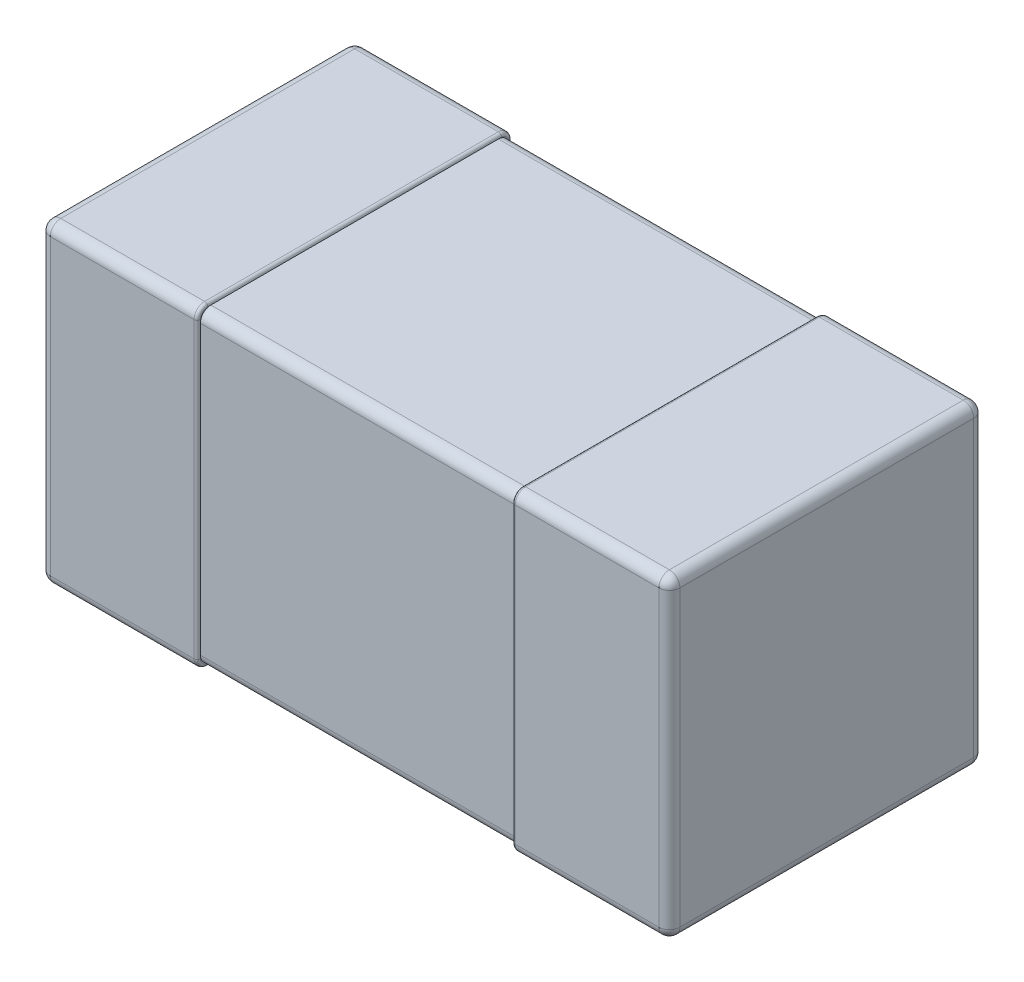
from build123d import *

# Parameters (mm, degrees)
SKETCH1_W                           = 0.6
SKETCH1_H                           = 0.3
ALL_BODY_DEPTH                      = 0.3
CUT_OUT_THE_BODY_FOR_PIN_DEPTH      = 0.15
CUT_OUT_THE_BODY_FOR_PIN_DEPTH_BACK = 0.15
SKETCH2_OUTSIDE_W                   = 2.446
SKETCH2_OUTSIDE_H                   = 2.446
SKETCH2_OUTSIDE_W_2                 = 0.294
SKETCH2_OUTSIDE_H_2                 = 0.294
BODY_FILLET_R                       = 0.01
PIN_FILLET_A_R                      = 0.01
PIN_FILLET_B_R                      = 0.003


with BuildPart() as part:
    # Sketch1 → All body (new body)
    with BuildSketch(Plane.XY):
        Rectangle(SKETCH1_W, SKETCH1_H)
    extrude(amount=ALL_BODY_DEPTH)

    # Sketch2 outside → Cut out the body for pin (cut, two sides: drawn at the far end of the back side and taken through both)
    with BuildSketch(Plane(origin=(0, 0, 0), x_dir=(0, 0, -1), z_dir=(1, 0, 0)).offset(-CUT_OUT_THE_BODY_FOR_PIN_DEPTH_BACK)):
        with Locations((-0.15, 0)):
            Rectangle(SKETCH2_OUTSIDE_W, SKETCH2_OUTSIDE_H)
        with Locations((-0.15, 0)):
            Rectangle(SKETCH2_OUTSIDE_W_2, SKETCH2_OUTSIDE_H_2, mode=Mode.SUBTRACT)
    extrude(amount=CUT_OUT_THE_BODY_FOR_PIN_DEPTH + CUT_OUT_THE_BODY_FOR_PIN_DEPTH_BACK, mode=Mode.SUBTRACT)

    # Body fillet
    body_fillet_edges = [part.edges().sort_by_distance(p)[0] for p in [
        (0, 0.147, 0.003),
        (0, 0.147, 0.297),
        (0, -0.147, 0.297),
        (0, -0.147, 0.003),
    ]]
    fillet(body_fillet_edges, radius=BODY_FILLET_R)

    # Pin fillet a
    pin_fillet_a_edges = [part.edges().sort_by_distance(p)[0] for p in [
        (0.3, 0, 0.3),
        (-0.225, 0.15, 0),
        (0.225, -0.15, 0),
        (0.225, -0.15, 0.3),
        (-0.225, 0.15, 0.3),
        (0.225, 0.15, 0.3),
        (-0.3, 0, 0.3),
        (0.225, 0.15, 0),
        (0.3, 0, 0),
        (-0.225, -0.15, 0),
        (-0.3, 0, 0),
        (-0.3, 0.15, 0.15),
        (0.3, 0.15, 0.15),
        (0.3, -0.15, 0.15),
        (-0.3, -0.15, 0.15),
        (-0.225, -0.15, 0.3),
    ]]
    fillet(pin_fillet_a_edges, radius=PIN_FILLET_A_R)

    # Pin fillet b
    pin_fillet_b_edges = [part.edges().sort_by_distance(p)[0] for p in [
        (0.15, -0.15, 0.15),
        (0.15, 0, 0.3),
        (0.15, 0.15, 0.15),
        (0.15, 0, 0),
        (-0.15, 0.15, 0.15),
        (-0.15, 0, 0.3),
        (-0.15, -0.15, 0.15),
        (-0.15, 0, 0),
        (0.15, 0.147071068, 0.002928932),
        (0.15, -0.147071068, 0.002928932),
        (0.15, -0.147071068, 0.297071068),
        (0.15, 0.147071068, 0.297071068),
        (-0.15, -0.147071068, 0.297071068),
        (-0.15, 0.147071068, 0.297071068),
        (-0.15, -0.147071068, 0.002928932),
        (-0.15, 0.147071068, 0.002928932),
    ]]
    fillet(pin_fillet_b_edges, radius=PIN_FILLET_B_R - 0.0001)  # a hair under: the kernel refuses the full size


solid = part.part
